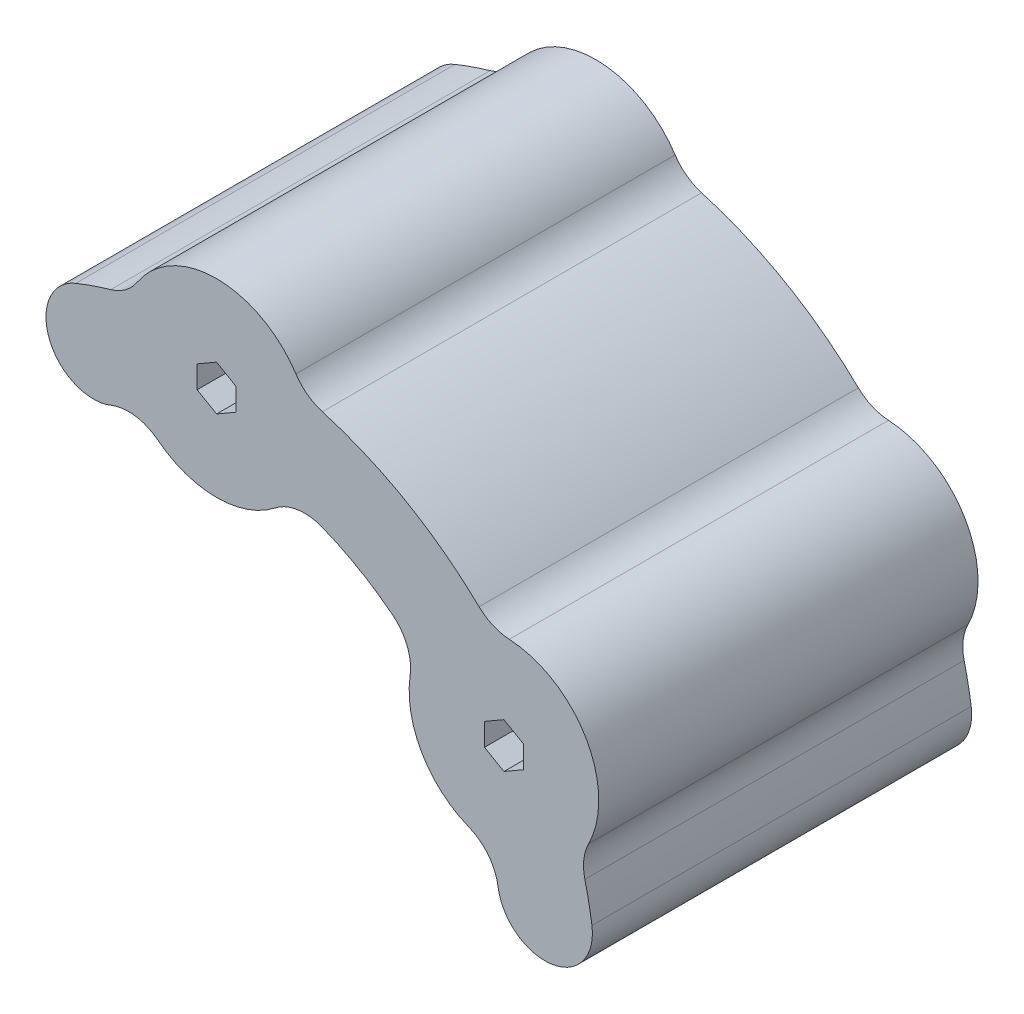
from build123d import *

# Parameters (mm, degrees)
SKETCH_1_R          = 80
SKETCH_1_R_2        = 60
EXTRUDE_1_DEPTH     = 80
CUT_EXTRUDE_1_DEPTH = 139.564064606
CUT_EXTRUDE_2_DEPTH = 139.564064606
SKETCH_4_R          = 20
SKETCH_4_R_2        = 7.5
EXTRUDE_2_DEPTH     = 80
FILLET_1_R          = 10


with BuildPart() as part:
    # 草图1 → 凸台-拉伸1 (new body)
    with BuildSketch(Plane.XY):
        Circle(SKETCH_1_R)
        Circle(SKETCH_1_R_2, mode=Mode.SUBTRACT)
    extrude(amount=EXTRUDE_1_DEPTH)

    # 草图2 → 切除-拉伸1 (cut, through all)
    with BuildSketch(Plane.XY.offset(80)):
        Polygon((60.621778265, 30.265727793), (64.721778265, 32.632863896), (64.721778265, 37.367136104), (60.621778265, 39.734272207), (56.521778265, 37.367136104), (56.521778265, 32.632863896), align=None)
        Polygon((4.1, 67.632863896), (4.1, 72.367136104), (0, 74.734272207), (-4.1, 72.367136104), (-4.1, 67.632863896), (0, 65.265727793), align=None)
        Polygon((56.521778265, -37.367136104), (60.621778265, -39.734272207), (64.721778265, -37.367136104), (64.721778265, -32.632863896), (60.621778265, -30.265727793), (56.521778265, -32.632863896), align=None)
        Polygon((-4.1, -67.632863896), (-4.1, -72.367136104), (0, -74.734272207), (4.1, -72.367136104), (4.1, -67.632863896), (0, -65.265727793), align=None)
        Polygon((-60.621778265, -30.265727793), (-64.721778265, -32.632863896), (-64.721778265, -37.367136104), (-60.621778265, -39.734272207), (-56.521778265, -37.367136104), (-56.521778265, -32.632863896), align=None)
        Polygon((-56.521778265, 37.367136104), (-60.621778265, 39.734272207), (-64.721778265, 37.367136104), (-64.721778265, 32.632863896), (-60.621778265, 30.265727793), (-56.521778265, 32.632863896), align=None)
    extrude(amount=-CUT_EXTRUDE_1_DEPTH, mode=Mode.SUBTRACT)

    # 草图3 → 切除-拉伸2 (cut, through all)
    with BuildSketch(Plane.XY.offset(80)):
        with BuildLine():
            Line((0, 0), (-40, 69.282032303))
            ThreePointArc((-40, 69.282032303), (-40, -69.282032303), (80, 0))
            Line((80, 0), (0, 0))
        make_face()
    extrude(amount=-CUT_EXTRUDE_2_DEPTH, mode=Mode.SUBTRACT)

    # 草图4 → 凸台-拉伸2 (add)
    # profile 1 of 2: a face of its own
    with BuildSketch(Plane.XY.offset(80)):
        with Locations((0, 70)):
            Circle(SKETCH_4_R)
        with Locations((0, 70)):
            Circle(SKETCH_4_R_2, mode=Mode.SUBTRACT)
    # profile 2 of 2: a face of its own
    with BuildSketch(Plane.XY.offset(80)):
        with Locations((60.621778265, 35)):
            Circle(SKETCH_4_R)
        with Locations((60.621778265, 35)):
            Circle(SKETCH_4_R_2, mode=Mode.SUBTRACT)
    extrude(amount=-EXTRUDE_2_DEPTH)

    # 圆角1
    fillet_1_edges = [part.edges().sort_by_distance(p)[0] for p in [
        (76.622258716, 23.000640628, 40),
        (58.230268445, 54.856502229, 40),
        (18.391990271, 77.857142857, 40),
        (-18.391990271, 77.857142857, 40),
        (15.891853901, 57.857142857, 40),
        (-15.891853901, 57.857142857, 40),
        (58.051682455, 15.165822237, 40),
        (42.159828554, 42.69132062, 40),
    ]]
    fillet(fillet_1_edges, radius=FILLET_1_R)
    fillet_1_2_edges = [part.edges().sort_by_distance(p)[0] for p in [
        (60, 0, 40),
        (80, 0, 40),
        (-30, 51.961524227, 40),
        (-40, 69.282032303, 40),
    ]]
    fillet(fillet_1_2_edges, radius=FILLET_1_R - 0.0001)  # a hair under: the kernel refuses the full size


solid = part.part
